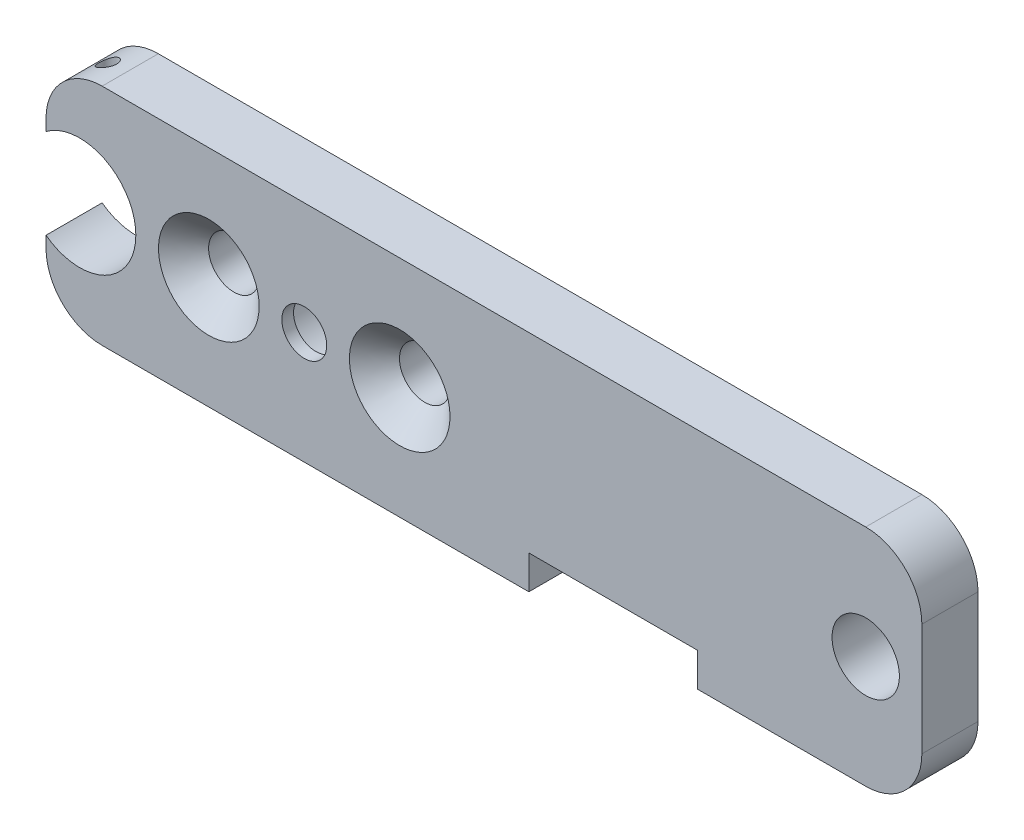
from build123d import *

# Parameters (mm, degrees)
SKETCH1_W                                            = 78
SKETCH1_H                                            = 20
BOSS_EXTRUDE1_DEPTH                                  = 5
F_10_0MM_DOWEL_HOLE1_D                               = 10
F_10_0MM_DOWEL_HOLE1_DEPTH                           = 25
F_10_0MM_DOWEL_HOLE1_TIP                             = 3.004303095
CSK_FOR_M4_HEX_SOCKET_COUNTERSUNK_CAP_SC_D           = 4.5
CSK_FOR_M4_HEX_SOCKET_COUNTERSUNK_CAP_SC_CSINK_D     = 8.96
CSK_FOR_M4_HEX_SOCKET_COUNTERSUNK_CAP_SC_CSINK_ANGLE = 90
F_6_0MM_DOWEL_HOLE1_D                                = 6
F_6_0MM_DOWEL_HOLE1_DEPTH                            = 25
F_6_0MM_DOWEL_HOLE1_TIP                              = 1.802581857
F_4_0MM_DOWEL_HOLE2_D                                = 4
F_4_0MM_DOWEL_HOLE2_DEPTH                            = 25
F_4_0MM_DOWEL_HOLE2_TIP                              = 1.201721238
F_8_0MM_DOWEL_HOLE1_D                                = 8
F_8_0MM_DOWEL_HOLE1_DEPTH                            = 2.75
F_8_0MM_DOWEL_HOLE1_TIP                              = 2.403442476
FILLET1_R                                            = 5
M2_TAPPED_HOLE1_D                                    = 1.6
M2_TAPPED_HOLE1_DEPTH                                = 7
M2_TAPPED_HOLE1_TIP                                  = 0.480688495
SKETCH22_W                                           = 15
SKETCH22_H                                           = 3
CUT_EXTRUDE1_DEPTH                                   = 10
M2_TAPPED_HOLE2_D                                    = 1.6
M2_TAPPED_HOLE2_DEPTH                                = 7
M2_TAPPED_HOLE2_TIP                                  = 0.480688495


with BuildPart() as part:
    # Sketch1 → Boss-Extrude1 (new body)
    with BuildSketch(Plane.XY):
        with Locations((11.697000354, -2.580625299)):
            Rectangle(SKETCH1_W, SKETCH1_H)
    extrude(amount=BOSS_EXTRUDE1_DEPTH)

    # Ø10.0mm Dowel Hole1
    with Locations(Plane(origin=(-24.302999646, -2.580625299, 5), x_dir=(1, 0, 0), z_dir=(0, 0, 1))):
        with Locations((0, 0)):
            Hole(F_10_0MM_DOWEL_HOLE1_D / 2, depth=F_10_0MM_DOWEL_HOLE1_DEPTH)
            with Locations((0, 0, -(F_10_0MM_DOWEL_HOLE1_DEPTH + F_10_0MM_DOWEL_HOLE1_TIP / 2))):  # 118° drill point
                Cone(0, F_10_0MM_DOWEL_HOLE1_D / 2, F_10_0MM_DOWEL_HOLE1_TIP, mode=Mode.SUBTRACT)

    # CSK for M4 Hex Socket Countersunk Cap Screw1 (through all)
    with Locations(Plane(origin=(-12.802999646, -2.580625299, 5), x_dir=(1, 0, 0), z_dir=(0, 0, 1))):
        with Locations((0, 0), (17, 0)):
            CounterSinkHole(CSK_FOR_M4_HEX_SOCKET_COUNTERSUNK_CAP_SC_D / 2, CSK_FOR_M4_HEX_SOCKET_COUNTERSUNK_CAP_SC_CSINK_D / 2, counter_sink_angle=CSK_FOR_M4_HEX_SOCKET_COUNTERSUNK_CAP_SC_CSINK_ANGLE)

    # Ø6.0mm Dowel Hole1
    with Locations(Plane(origin=(45.697000354, -2.580625299, 5), x_dir=(1, 0, 0), z_dir=(0, 0, 1))):
        with Locations((0, 0)):
            Hole(F_6_0MM_DOWEL_HOLE1_D / 2, depth=F_6_0MM_DOWEL_HOLE1_DEPTH)
            with Locations((0, 0, -(F_6_0MM_DOWEL_HOLE1_DEPTH + F_6_0MM_DOWEL_HOLE1_TIP / 2))):  # 118° drill point
                Cone(0, F_6_0MM_DOWEL_HOLE1_D / 2, F_6_0MM_DOWEL_HOLE1_TIP, mode=Mode.SUBTRACT)

    # Ø4.0mm Dowel Hole2
    with Locations(Plane(origin=(-4.302999646, -2.580625299, 0), x_dir=(-1, 0, 0), z_dir=(0, 0, -1))):
        with Locations((0, 0)):
            Hole(F_4_0MM_DOWEL_HOLE2_D / 2, depth=F_4_0MM_DOWEL_HOLE2_DEPTH)
            with Locations((0, 0, -(F_4_0MM_DOWEL_HOLE2_DEPTH + F_4_0MM_DOWEL_HOLE2_TIP / 2))):  # 118° drill point
                Cone(0, F_4_0MM_DOWEL_HOLE2_D / 2, F_4_0MM_DOWEL_HOLE2_TIP, mode=Mode.SUBTRACT)

    # Ø8.0mm Dowel Hole1
    with Locations(Plane(origin=(-4.302999646, -2.580625299, 0), x_dir=(-1, 0, 0), z_dir=(0, 0, -1))):
        with Locations((0, 0)):
            Hole(F_8_0MM_DOWEL_HOLE1_D / 2, depth=F_8_0MM_DOWEL_HOLE1_DEPTH)
            with Locations((0, 0, -(F_8_0MM_DOWEL_HOLE1_DEPTH + F_8_0MM_DOWEL_HOLE1_TIP / 2))):  # 118° drill point
                Cone(0, F_8_0MM_DOWEL_HOLE1_D / 2, F_8_0MM_DOWEL_HOLE1_TIP, mode=Mode.SUBTRACT)

    # Fillet1
    fillet1_edges = [part.edges().sort_by_distance(p)[0] for p in [
        (50.697000354, 7.419374701, 2.5),
        (50.697000354, -12.580625299, 2.5),
        (-27.302999646, -12.580625299, 2.5),
        (-27.302999646, 7.419374701, 2.5),
    ]]
    fillet(fillet1_edges, radius=FILLET1_R)

    # M2 Tapped Hole1
    with Locations(Plane(origin=(-24.302999646, 7.419374701, 2.5), x_dir=(0, 0, 1), z_dir=(0, 1, 0))):
        with Locations((0, 0)):
            Hole(M2_TAPPED_HOLE1_D / 2, depth=M2_TAPPED_HOLE1_DEPTH)
            with Locations((0, 0, -(M2_TAPPED_HOLE1_DEPTH + M2_TAPPED_HOLE1_TIP / 2))):  # 118° drill point
                Cone(0, M2_TAPPED_HOLE1_D / 2, M2_TAPPED_HOLE1_TIP, mode=Mode.SUBTRACT)

    # Sketch22 → Cut-Extrude1 (cut)
    with BuildSketch(Plane(origin=(0, 0, 0), x_dir=(-1, 0, 0), z_dir=(0, 0, -1))):
        with Locations((-23.197000354, -11.080625299)):
            Rectangle(SKETCH22_W, SKETCH22_H)
    extrude(amount=-CUT_EXTRUDE1_DEPTH, mode=Mode.SUBTRACT)

    # M2 Tapped Hole2
    with Locations(Plane(origin=(23.197000354, -9.580625299, 2.5), x_dir=(0, 0, -1), z_dir=(0, -1, 0))):
        with Locations((0, 0)):
            Hole(M2_TAPPED_HOLE2_D / 2, depth=M2_TAPPED_HOLE2_DEPTH)
            with Locations((0, 0, -(M2_TAPPED_HOLE2_DEPTH + M2_TAPPED_HOLE2_TIP / 2))):  # 118° drill point
                Cone(0, M2_TAPPED_HOLE2_D / 2, M2_TAPPED_HOLE2_TIP, mode=Mode.SUBTRACT)


solid = part.part
